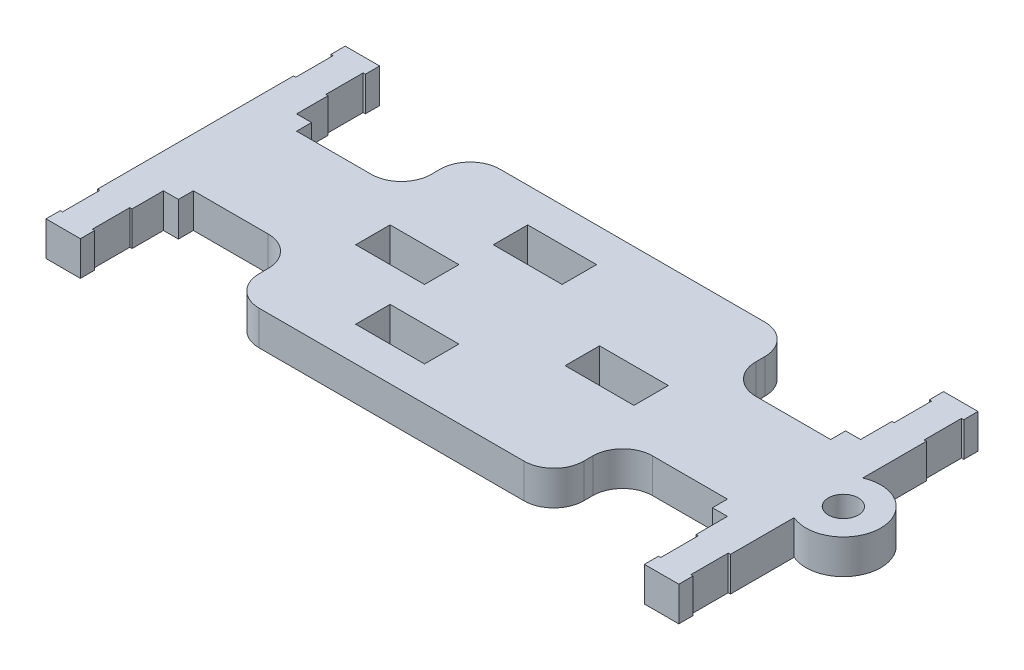
from build123d import *

# Parameters (mm, degrees)
SKETCH1_W          = 42.3
SKETCH1_H          = 20
SKETCH1_W_2        = 4.6
SKETCH1_H_2        = 2.3
BASE_FLANGE1_DEPTH = 2.3
CUT_EXTRUDE1_REACH = 25.508
CUT_EXTRUDE2_REACH = 25.508
SKETCH7_W          = 0.15
SKETCH7_H          = 2.5
SKETCH8_R          = 2.5
SKETCH8_R_2        = 1
TAB1_DEPTH         = 2.3


# Sheet-metal steps are written as plain solids
with BuildPart() as part:
    # Sketch1 → Base-Flange1 (new body)
    with BuildSketch(Plane(origin=(0, 0, 0), x_dir=(1, 0, 0), z_dir=(0, 1, 0))):
        Rectangle(SKETCH1_W, SKETCH1_H)
        with Locations((-7, 0)):
            Rectangle(SKETCH1_W_2, SKETCH1_H_2, mode=Mode.SUBTRACT)
        with Locations((-2.4, -4.6)):
            Rectangle(SKETCH1_W_2, SKETCH1_H_2, mode=Mode.SUBTRACT)
        with Locations((7, 0)):
            Rectangle(SKETCH1_W_2, SKETCH1_H_2, mode=Mode.SUBTRACT)
        with Locations((-2.4, 4.6)):
            Rectangle(SKETCH1_W_2, SKETCH1_H_2, mode=Mode.SUBTRACT)
    extrude(amount=-BASE_FLANGE1_DEPTH)

    # Sketch6 → Cut-Extrude1 (cut, up to next)
    with BuildSketch(Plane(origin=(0, 0, 0), x_dir=(1, 0, 0), z_dir=(0, 1, 0)), mode=Mode.PRIVATE) as cut_extrude1_sk1:
        with BuildLine():
            Line((-18.85, 10), (-18.85, 4.45))
            Line((-18.85, 4.45), (-17.85, 4.45))
            Line((-17.85, 4.45), (-17.85, 3.45))
            Line((-17.85, 3.45), (-12.85, 3.45))
            ThreePointArc((-12.85, 3.45), (-11.435786438, 4.035786438), (-10.85, 5.45))
            Line((-10.85, 5.45), (-10.85, 6.05))
            ThreePointArc((-10.85, 6.05), (-10.264213562, 7.464213562), (-8.85, 8.05))
            Line((-8.85, 8.05), (8.85, 8.05))
            ThreePointArc((8.85, 8.05), (10.264213562, 7.464213562), (10.85, 6.05))
            Line((10.85, 6.05), (10.85, 5.45))
            ThreePointArc((10.85, 5.45), (11.435786438, 4.035786438), (12.85, 3.45))
            Line((12.85, 3.45), (17.85, 3.45))
            Line((17.85, 3.45), (17.85, 4.45))
            Line((17.85, 4.45), (18.85, 4.45))
            Line((18.85, 4.45), (18.85, 10))
            Line((18.85, 10), (-18.85, 10))
        make_face()
    cut_extrude1_tool1 = extrude(cut_extrude1_sk1.sketch, amount=-CUT_EXTRUDE1_REACH, mode=Mode.PRIVATE) & part.part
    # Sketch6 → Cut-Extrude1 (cut, up to next)
    with BuildSketch(Plane(origin=(0, 0, 0), x_dir=(1, 0, 0), z_dir=(0, 1, 0)), mode=Mode.PRIVATE) as cut_extrude1_sk2:
        with BuildLine():
            Line((18.85, -10), (-18.85, -10))
            Line((-18.85, -10), (-18.85, -4.45))
            Line((-18.85, -4.45), (-17.85, -4.45))
            Line((-17.85, -4.45), (-17.85, -3.45))
            Line((-17.85, -3.45), (-12.85, -3.45))
            ThreePointArc((-12.85, -3.45), (-11.435786438, -4.035786438), (-10.85, -5.45))
            Line((-10.85, -5.45), (-10.85, -6.05))
            ThreePointArc((-10.85, -6.05), (-10.264213562, -7.464213562), (-8.85, -8.05))
            Line((-8.85, -8.05), (8.85, -8.05))
            ThreePointArc((8.85, -8.05), (10.264213562, -7.464213562), (10.85, -6.05))
            Line((10.85, -6.05), (10.85, -5.45))
            ThreePointArc((10.85, -5.45), (11.435786438, -4.035786438), (12.85, -3.45))
            Line((12.85, -3.45), (17.85, -3.45))
            Line((17.85, -3.45), (17.85, -4.45))
            Line((17.85, -4.45), (18.85, -4.45))
            Line((18.85, -4.45), (18.85, -10))
        make_face()
    cut_extrude1_tool2 = extrude(cut_extrude1_sk2.sketch, amount=-CUT_EXTRUDE1_REACH, mode=Mode.PRIVATE) & part.part
    add(cut_extrude1_tool1.solids().sort_by_distance((15.35, 0, -3.832648))[0], mode=Mode.SUBTRACT)
    add(cut_extrude1_tool2.solids().sort_by_distance((15.35, 0, 3.832648))[0], mode=Mode.SUBTRACT)

    # Sketch7 → Cut-Extrude2 (cut, up to next)
    with BuildSketch(Plane(origin=(0, 0, 0), x_dir=(1, 0, 0), z_dir=(0, 1, 0)), mode=Mode.PRIVATE) as cut_extrude2_sk1:
        with Locations((-21.075, 7.8)):
            Rectangle(SKETCH7_W, SKETCH7_H)
    cut_extrude2_tool1 = extrude(cut_extrude2_sk1.sketch, amount=-CUT_EXTRUDE2_REACH, mode=Mode.PRIVATE) & part.part
    # Sketch7 → Cut-Extrude2 (cut, up to next)
    with BuildSketch(Plane(origin=(0, 0, 0), x_dir=(1, 0, 0), z_dir=(0, 1, 0)), mode=Mode.PRIVATE) as cut_extrude2_sk2:
        with Locations((-18.925, 7.8)):
            Rectangle(SKETCH7_W, SKETCH7_H)
    cut_extrude2_tool2 = extrude(cut_extrude2_sk2.sketch, amount=-CUT_EXTRUDE2_REACH, mode=Mode.PRIVATE) & part.part
    # Sketch7 → Cut-Extrude2 (cut, up to next)
    with BuildSketch(Plane(origin=(0, 0, 0), x_dir=(1, 0, 0), z_dir=(0, 1, 0)), mode=Mode.PRIVATE) as cut_extrude2_sk3:
        with Locations((-21.075, -7.8)):
            Rectangle(SKETCH7_W, SKETCH7_H)
    cut_extrude2_tool3 = extrude(cut_extrude2_sk3.sketch, amount=-CUT_EXTRUDE2_REACH, mode=Mode.PRIVATE) & part.part
    # Sketch7 → Cut-Extrude2 (cut, up to next)
    with BuildSketch(Plane(origin=(0, 0, 0), x_dir=(1, 0, 0), z_dir=(0, 1, 0)), mode=Mode.PRIVATE) as cut_extrude2_sk4:
        with Locations((-18.925, -7.8)):
            Rectangle(SKETCH7_W, SKETCH7_H)
    cut_extrude2_tool4 = extrude(cut_extrude2_sk4.sketch, amount=-CUT_EXTRUDE2_REACH, mode=Mode.PRIVATE) & part.part
    # Sketch7 → Cut-Extrude2 (cut, up to next)
    with BuildSketch(Plane(origin=(0, 0, 0), x_dir=(1, 0, 0), z_dir=(0, 1, 0)), mode=Mode.PRIVATE) as cut_extrude2_sk5:
        with Locations((21.075, -7.8)):
            Rectangle(SKETCH7_W, SKETCH7_H)
    cut_extrude2_tool5 = extrude(cut_extrude2_sk5.sketch, amount=-CUT_EXTRUDE2_REACH, mode=Mode.PRIVATE) & part.part
    # Sketch7 → Cut-Extrude2 (cut, up to next)
    with BuildSketch(Plane(origin=(0, 0, 0), x_dir=(1, 0, 0), z_dir=(0, 1, 0)), mode=Mode.PRIVATE) as cut_extrude2_sk6:
        with Locations((18.925, -7.8)):
            Rectangle(SKETCH7_W, SKETCH7_H)
    cut_extrude2_tool6 = extrude(cut_extrude2_sk6.sketch, amount=-CUT_EXTRUDE2_REACH, mode=Mode.PRIVATE) & part.part
    # Sketch7 → Cut-Extrude2 (cut, up to next)
    with BuildSketch(Plane(origin=(0, 0, 0), x_dir=(1, 0, 0), z_dir=(0, 1, 0)), mode=Mode.PRIVATE) as cut_extrude2_sk7:
        with Locations((21.075, 7.8)):
            Rectangle(SKETCH7_W, SKETCH7_H)
    cut_extrude2_tool7 = extrude(cut_extrude2_sk7.sketch, amount=-CUT_EXTRUDE2_REACH, mode=Mode.PRIVATE) & part.part
    # Sketch7 → Cut-Extrude2 (cut, up to next)
    with BuildSketch(Plane(origin=(0, 0, 0), x_dir=(1, 0, 0), z_dir=(0, 1, 0)), mode=Mode.PRIVATE) as cut_extrude2_sk8:
        with Locations((18.925, 7.8)):
            Rectangle(SKETCH7_W, SKETCH7_H)
    cut_extrude2_tool8 = extrude(cut_extrude2_sk8.sketch, amount=-CUT_EXTRUDE2_REACH, mode=Mode.PRIVATE) & part.part
    add(cut_extrude2_tool1.solids().sort_by_distance((-21.075, 0, -7.8))[0], mode=Mode.SUBTRACT)
    add(cut_extrude2_tool2.solids().sort_by_distance((-18.925, 0, -7.8))[0], mode=Mode.SUBTRACT)
    add(cut_extrude2_tool3.solids().sort_by_distance((-21.075, 0, 7.8))[0], mode=Mode.SUBTRACT)
    add(cut_extrude2_tool4.solids().sort_by_distance((-18.925, 0, 7.8))[0], mode=Mode.SUBTRACT)
    add(cut_extrude2_tool5.solids().sort_by_distance((21.075, 0, 7.8))[0], mode=Mode.SUBTRACT)
    add(cut_extrude2_tool6.solids().sort_by_distance((18.925, 0, 7.8))[0], mode=Mode.SUBTRACT)
    add(cut_extrude2_tool7.solids().sort_by_distance((21.075, 0, -7.8))[0], mode=Mode.SUBTRACT)
    add(cut_extrude2_tool8.solids().sort_by_distance((18.925, 0, -7.8))[0], mode=Mode.SUBTRACT)

    # Sketch8 → Tab1 (add)
    with BuildSketch(Plane(origin=(0, 0, 0), x_dir=(1, 0, 0), z_dir=(0, 1, 0))):
        with Locations((22.15, 0)):
            Circle(SKETCH8_R)
        with Locations(Location((22.15, 0, 0), (0, 0, 270))):
            Circle(SKETCH8_R_2, mode=Mode.SUBTRACT)
    extrude(amount=-TAB1_DEPTH)


solid = part.part
